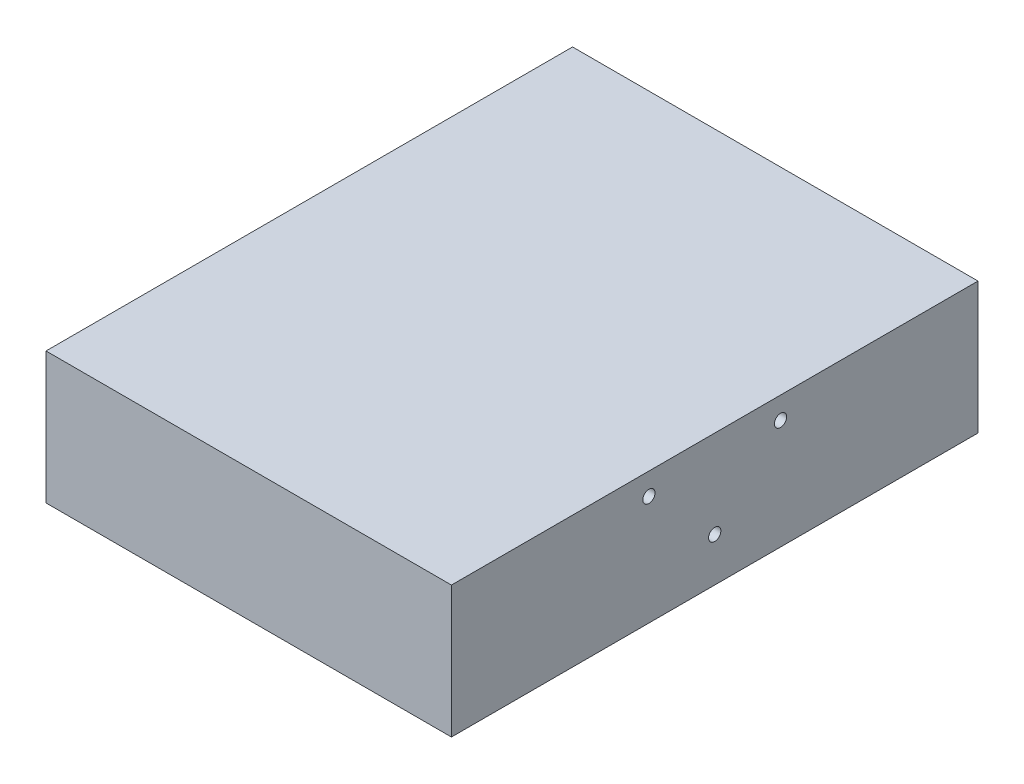
from build123d import *

# Parameters (mm, degrees)
SKETCH1_W           = 117.348
SKETCH1_H           = 38.1
BOSS_EXTRUDE1_DEPTH = 152.4
SKETCH2_R           = 1.778
CUT_EXTRUDE1_DEPTH  = 152.4


with BuildPart() as part:
    # Sketch1 → Boss-Extrude1 (new body)
    with BuildSketch(Plane.XY):
        with Locations((-58.674, -19.05)):
            Rectangle(SKETCH1_W, SKETCH1_H)
    extrude(amount=BOSS_EXTRUDE1_DEPTH)

    # Sketch2 → Cut-Extrude1 (cut)
    with BuildSketch(Plane(origin=(0, 0, 0), x_dir=(0, 0, -1), z_dir=(1, 0, 0))):
        with Locations((-76.2, -25.4)):
            Circle(SKETCH2_R)
        with Locations((-95.25, -6.35)):
            Circle(SKETCH2_R)
        with Locations((-57.15, -6.35)):
            Circle(SKETCH2_R)
    extrude(amount=-CUT_EXTRUDE1_DEPTH, mode=Mode.SUBTRACT)


solid = part.part
